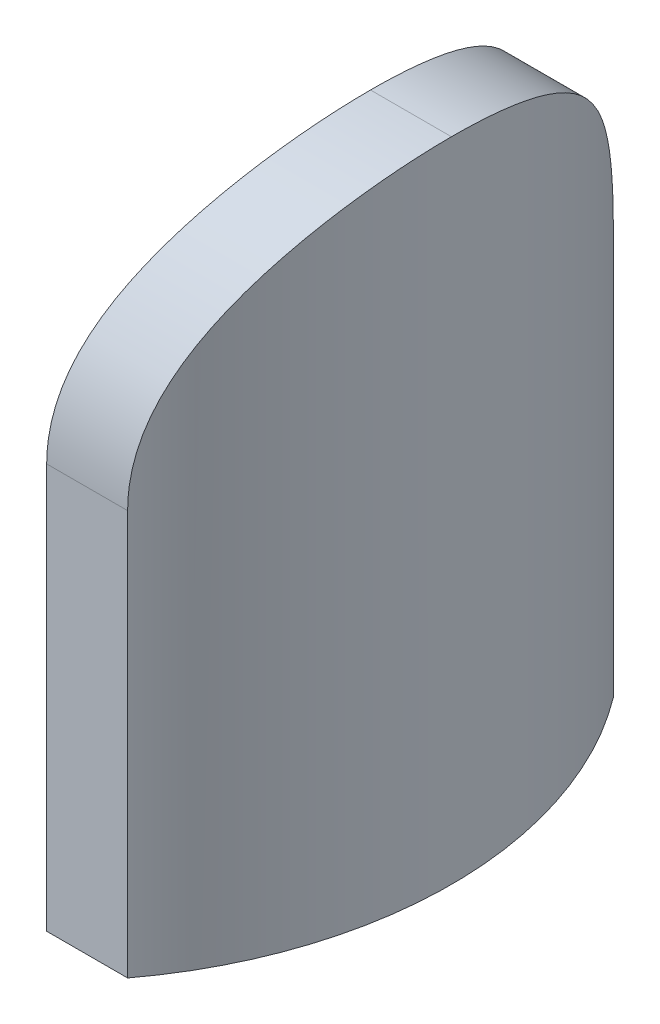
from build123d import *

# Parameters (mm, degrees)
SKETCH1_W           = 10
SKETCH1_H           = 30
BOSS_EXTRUDE1_DEPTH = 40
FILLET1_R           = 15
CUT_EXTRUDE1_DEPTH  = 40
SHELL2_T            = -1


with BuildPart() as part:
    # Sketch1 → Boss-Extrude1 (new body)
    with BuildSketch(Plane(origin=(0, 0, 0), x_dir=(1, 0, 0), z_dir=(0, 1, 0))):
        with Locations((5, 15)):
            Rectangle(SKETCH1_W, SKETCH1_H)
    extrude(amount=BOSS_EXTRUDE1_DEPTH)

    # Fillet1
    fillet1_edges = [part.edges().sort_by_distance(p)[0] for p in [
        (5, 40, -30),
        (5, 40, 0),
    ]]
    fillet(fillet1_edges, radius=FILLET1_R - 0.0001)  # a hair under: the kernel refuses the full size

    # Sketch2 → Cut-Extrude1 (cut)
    with BuildSketch(Plane.XZ):
        with BuildLine():
            Line((10, 0), (5, 0))
            ThreePointArc((5, 0), (8.717082451, -7.09430585), (10, -15))
            Line((10, -15), (10, 0))
        make_face()
        with BuildLine():
            Line((10, -30), (10, -15))
            ThreePointArc((10, -15), (8.717082451, -22.90569415), (5, -30))
            Line((5, -30), (10, -30))
        make_face()
        with BuildLine():
            ThreePointArc((0, 0), (5, -15), (0, -30))
            Line((0, -30), (0, 0))
        make_face()
    extrude(amount=-CUT_EXTRUDE1_DEPTH, mode=Mode.SUBTRACT)

    # Shell2
    shell2_openings = [part.faces().sort_by_distance(p)[0] for p in [
        (5.9062731, 0, -15),
    ]]
    offset(amount=SHELL2_T, openings=shell2_openings)


solid = part.part
